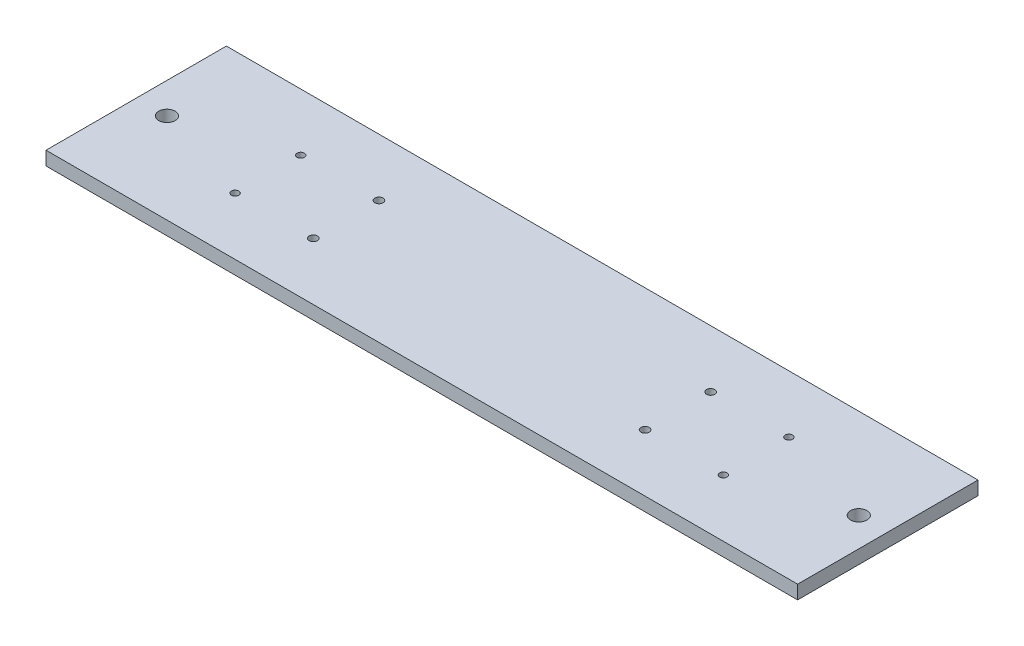
from build123d import *

# Parameters (mm, degrees)
SKETCH1_W           = 550
SKETCH1_H           = 72
SKETCH1_R           = 2.7
SKETCH1_R_2         = 3.027392676
SKETCH1_R_3         = 6
BOSS_EXTRUDE1_DEPTH = 10
SKETCH2_W           = 550
SKETCH2_H           = 10
BOSS_EXTRUDE2_DEPTH = 30


with BuildPart() as part:
    # Sketch1 → Boss-Extrude1 (new body)
    with BuildSketch(Plane(origin=(0, 0, 0), x_dir=(1, 0, 0), z_dir=(0, 1, 0))):
        Rectangle(SKETCH1_W, SKETCH1_H)
        with Locations((-178.63, 24)):
            Circle(SKETCH1_R, mode=Mode.SUBTRACT)
        with Locations((-121.37, 24)):
            Circle(SKETCH1_R_2, mode=Mode.SUBTRACT)
        with Locations((-178.63, -24)):
            Circle(SKETCH1_R, mode=Mode.SUBTRACT)
        with Locations((-121.37, -24)):
            Circle(SKETCH1_R_2, mode=Mode.SUBTRACT)
        with Locations((121.37, 24)):
            Circle(SKETCH1_R_2, mode=Mode.SUBTRACT)
        with Locations((121.37, -24)):
            Circle(SKETCH1_R_2, mode=Mode.SUBTRACT)
        with Locations((178.63, -24)):
            Circle(SKETCH1_R, mode=Mode.SUBTRACT)
        with Locations((178.63, 24)):
            Circle(SKETCH1_R, mode=Mode.SUBTRACT)
        with Locations((-252.5, 0)):
            Circle(SKETCH1_R_3, mode=Mode.SUBTRACT)
        with Locations((253.76, 0)):
            Circle(SKETCH1_R_3, mode=Mode.SUBTRACT)
    extrude(amount=BOSS_EXTRUDE1_DEPTH)

    # Sketch2 → Boss-Extrude2 (add)
    with BuildSketch(Plane(origin=(0, 0, -36), x_dir=(-1, 0, 0), z_dir=(0, 0, -1))):
        with Locations((0, 5)):
            Rectangle(SKETCH2_W, SKETCH2_H)
    boss_extrude2 = extrude(amount=BOSS_EXTRUDE2_DEPTH)

    # Mirror1: Boss-Extrude2 across plane
    add(boss_extrude2.mirror(Plane.XY))


solid = part.part
